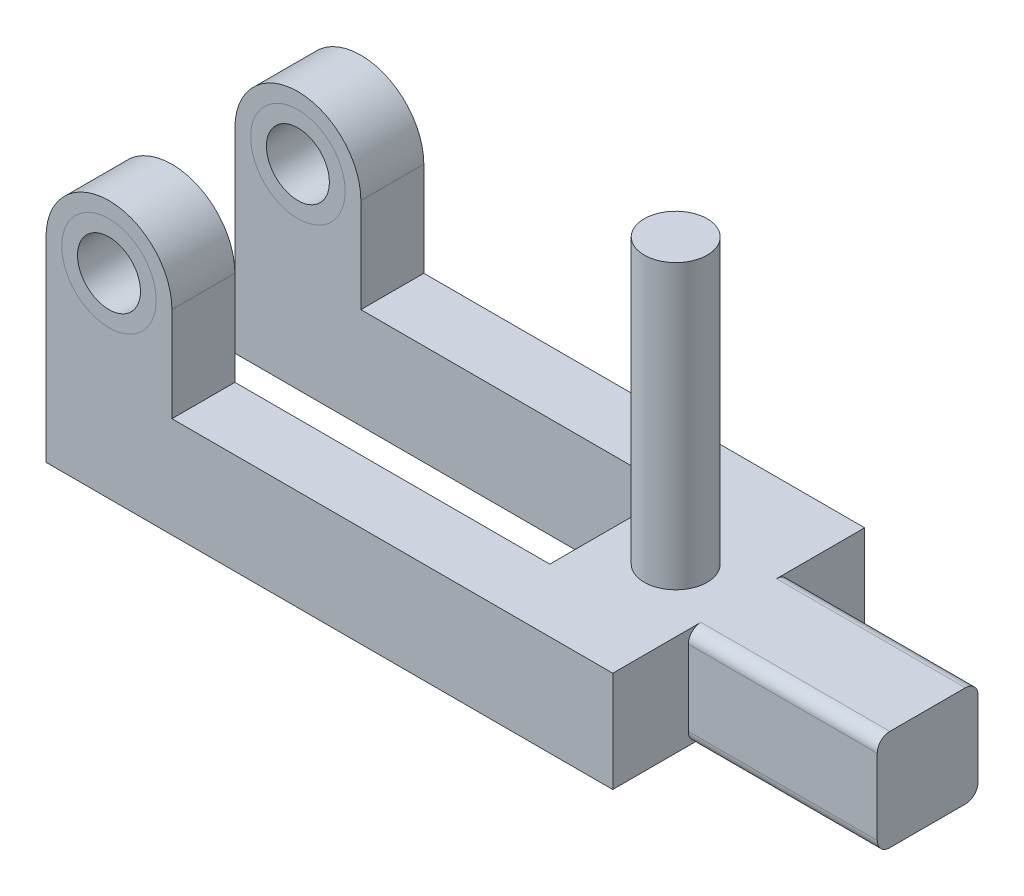
from build123d import *

# Parameters (mm, degrees)
BOSS_EXTRUDE1_DEPTH   = 16
FILLET1_R             = 2
SKETCH3_R             = 7.5
BOSS_EXTRUDE2_DEPTH   = 10
SKETCH4_R             = 5
BOSS_EXTRUDE3_DEPTH   = 45
SKETCH5_R             = 7.5
SKETCH5_R_2           = 5
BOSS_EXTRUDE4_DEPTH   = 10
LPATTERN1_START       = -40
LPATTERN1_OUTLINE_R   = 7.5
LPATTERN1_OUTLINE_R_2 = 5
LPATTERN1_DEPTH       = 10
LPATTERN1_2_OUTLINE_R = 7.5
LPATTERN1_2_DEPTH     = 10


# Read off the part's stored shape, not the designer's step: LPattern1
with BuildPart() as part:
    # Sketch2 → Boss-Extrude1 (new body)
    with BuildSketch(Plane(origin=(0, 0, 0), x_dir=(1, 0, 0), z_dir=(0, 1, 0))):
        Polygon((0, 30), (0, 40), (90, 40), (90, 28), (120, 28), (120, 12), (90, 12), (90, 0), (0, 0), (0, 10), (70, 10), (70, 30), align=None)
    extrude(amount=BOSS_EXTRUDE1_DEPTH)

    # Fillet1
    fillet1_edges = [part.edges().sort_by_distance(p)[0] for p in [
        (105, 16, -12),
        (105, 0, -28),
        (105, 0, -12),
        (105, 16, -28),
    ]]
    fillet(fillet1_edges, radius=FILLET1_R)

    # Sketch3 → Boss-Extrude2 (add)
    with BuildSketch(Plane.XY):
        with BuildLine():
            Line((0, 16), (20, 16))
            Line((20, 16), (20, 31))
            ThreePointArc((20, 31), (10, 41), (0, 31))
            Line((0, 31), (0, 16))
        make_face()
        with Locations((10, 31)):
            Circle(SKETCH3_R, mode=Mode.SUBTRACT)
    extrude(amount=-BOSS_EXTRUDE2_DEPTH)

    # Sketch4 → Boss-Extrude3 (add)
    with BuildSketch(Plane(origin=(0, 16, 0), x_dir=(1, 0, 0), z_dir=(0, 1, 0))):
        with Locations(Location((80, 20, 0), (0, 0, 90))):
            Circle(SKETCH4_R)
    extrude(amount=BOSS_EXTRUDE3_DEPTH)

    # LPattern1 2 outline → LPattern1 2 (add)
    with BuildSketch(Plane.XY.offset(LPATTERN1_START)):
        with BuildLine():
            Line((0, 31), (0, 16))
            Line((0, 16), (20, 16))
            Line((20, 16), (20, 31))
            ThreePointArc((20, 31), (10, 41), (0, 31))
        make_face()
        with Locations((10, 31)):
            Circle(LPATTERN1_2_OUTLINE_R, mode=Mode.SUBTRACT)
    extrude(amount=LPATTERN1_2_DEPTH)


with BuildPart() as body_2:
    # Sketch5 → Boss-Extrude4 (new body)
    with BuildSketch(Plane.XY):
        with Locations((10, 31)):
            Circle(SKETCH5_R)
        with Locations((10, 31)):
            Circle(SKETCH5_R_2, mode=Mode.SUBTRACT)
    extrude(amount=-BOSS_EXTRUDE4_DEPTH)


with BuildPart() as body_3:
    # LPattern1 outline → LPattern1 (new body)
    with BuildSketch(Plane.XY.offset(LPATTERN1_START)):
        with Locations((10, 31)):
            Circle(LPATTERN1_OUTLINE_R)
        with Locations((10, 31)):
            Circle(LPATTERN1_OUTLINE_R_2, mode=Mode.SUBTRACT)
    extrude(amount=LPATTERN1_DEPTH)


solid = Compound([part.part, body_2.part, body_3.part])
